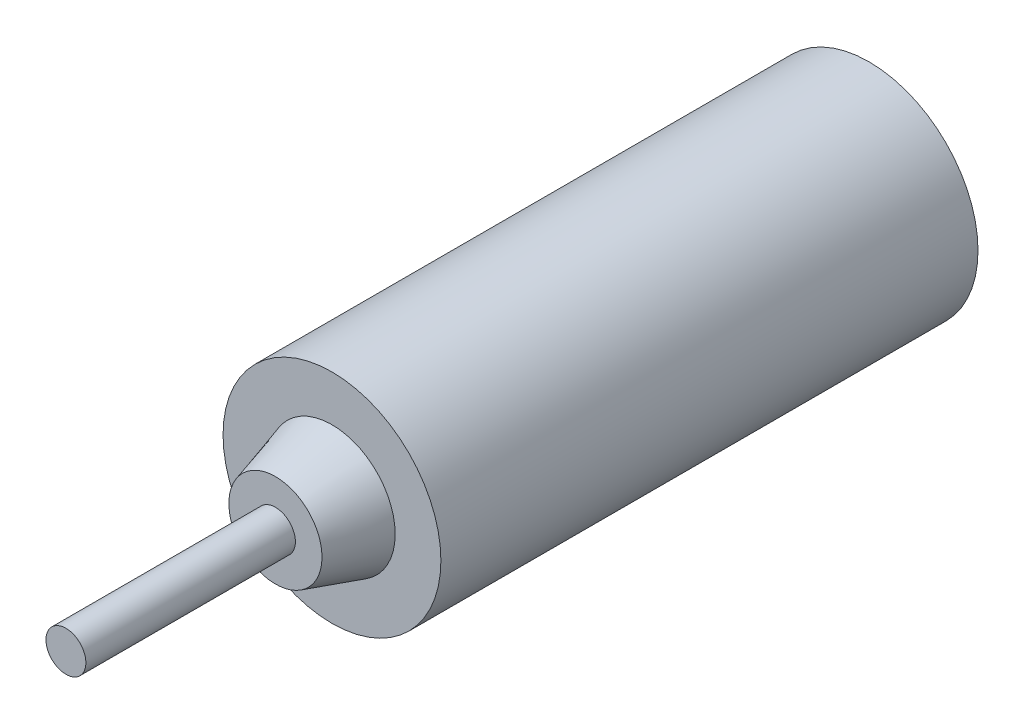
from build123d import *

# Parameters (mm, degrees)
SKETCH1_R           = 32.75
BOSS_EXTRUDE1_DEPTH = 80.75
SKETCH12_R          = 6
BOSS_EXTRUDE5_DEPTH = 63


with BuildPart() as part:
    # Sketch1 → Boss-Extrude1 (new, symmetric)
    with BuildSketch(Plane.XY):
        Circle(SKETCH1_R)
    extrude(amount=BOSS_EXTRUDE1_DEPTH, both=True)

    # Sketch10 → Revolve1 (revolve)
    with BuildSketch(Plane(origin=(0, 0, 0), x_dir=(0, 0, -1), z_dir=(1, 0, 0))):
        Polygon((-97.75, 0), (-97.75, 14), (-80.75, 19), (-80.75, 0), align=None)
    revolve(axis=Axis((0, 0, 1000), (0, 0, -1)))

    # Sketch12 → Boss-Extrude5 (add)
    with BuildSketch(Plane.XY.offset(97.75)):
        Circle(SKETCH12_R)
    extrude(amount=BOSS_EXTRUDE5_DEPTH)


solid = part.part
